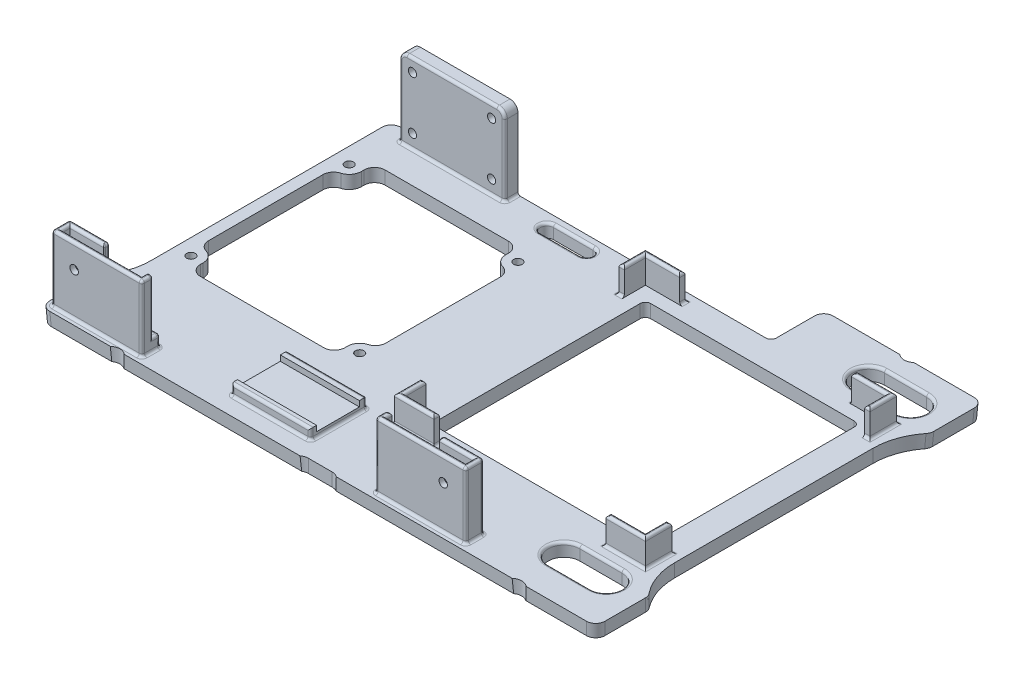
from build123d import *

# Parameters (mm, degrees)
SKETCH1_W               = 210
SKETCH1_H               = 146.5
BOSS_EXTRUDE1_DEPTH     = 5
DRAFT2_ANGLE            = 3
SKETCH2_R               = 1.625
CUT_EXTRUDE1_DEPTH      = 129.487807575
BOSS_EXTRUDE2_DEPTH     = 25
SKETCH6_W               = 34.2
SKETCH6_H               = 6.9
BOSS_EXTRUDE3_DEPTH     = 4.54
SKETCH7_W               = 30
SKETCH7_H               = 21.3
BOSS_EXTRUDE4_DEPTH     = 4
CUT_EXTRUDE2_REACH      = 167.336
SKETCH8_W               = 16.2274
SKETCH8_H               = 2.2
CUT_EXTRUDE3_DEPTH      = 182.532670176
CUT_EXTRUDE3_DEPTH_BACK = 182.532670176
SKETCH9_R               = 1.6
BOSS_EXTRUDE5_DEPTH     = 10
SKETCH13_W              = 81.17
SKETCH13_H              = 81.17
CUT_EXTRUDE5_DEPTH      = 131.801822217
SKETCH14_W              = 40
SKETCH14_H              = 5
BOSS_EXTRUDE6_DEPTH     = 30
SKETCH15_R              = 2.8
CUT_EXTRUDE6_DEPTH      = 2
CUT_EXTRUDE7_REACH      = 170.642
SKETCH16_R              = 1.55
FILLET3_R               = 1
FILLET5_R               = 4
FILLET2_R               = 2
FILLET1_R               = 3.5
FILLET6_R               = 3


# Some blends are built 0.0001 mm under size
with BuildPart() as part:
    # Sketch1 → Boss-Extrude1 (new body)
    with BuildSketch(Plane(origin=(0, 0, 0), x_dir=(1, 0, 0), z_dir=(0, 1, 0))):
        Rectangle(SKETCH1_W, SKETCH1_H)
    extrude(amount=BOSS_EXTRUDE1_DEPTH)

    # Draft2
    draft2_faces = [part.faces().sort_by_distance(p)[0] for p in [
        (105, 2.5, 0),
        (0, 2.5, -73.25),
        (-105, 2.5, 0),
        (0, 2.5, 73.25),
    ]]
    draft(draft2_faces, Plane(origin=(0, 0, 0), x_dir=(0, 0, -1), z_dir=(0, -1, 0)), DRAFT2_ANGLE)

    # Sketch2 → Cut-Extrude1 (cut, through all)
    with BuildSketch(Plane(origin=(0, 5, 0), x_dir=(1, 0, 0), z_dir=(0, 1, 0))):
        with Locations(Location((-93.262038896, 31.512038896, 0), (0, 0, 270))):
            Circle(SKETCH2_R)
        with Locations(Location((-29.262038896, 31.512038896, 0), (0, 0, 270))):
            Circle(SKETCH2_R)
        with Locations(Location((-29.262038896, -28.487961104, 0), (0, 0, 270))):
            Circle(SKETCH2_R)
        with Locations(Location((-93.262038896, -28.487961104, 0), (0, 0, 270))):
            Circle(SKETCH2_R)
        with BuildLine():
            Line((-105.262038896, 73.512038896), (44.737961104, 73.512038896))
            Line((44.737961104, 73.512038896), (44.737961104, 53.512038896))
            Line((44.737961104, 53.512038896), (-99.262038896, 53.512038896))
            Line((-99.262038896, 53.512038896), (-99.262038896, -37.566964284))
            ThreePointArc((-99.262038896, -37.566964284), (-100.812072144, -46.05402473), (-105.262038896, -53.445275908))
            Line((-105.262038896, -53.445275908), (-105.262038896, 53.512038896))
            Line((-105.262038896, 53.512038896), (-105.262038896, 73.512038896))
        make_face()
        with BuildLine():
            Line((73.554724092, 73.512038896), (78.845275908, 73.512038896))
            ThreePointArc((78.845275908, 73.512038896), (76.2, 72.512458096), (73.554724092, 73.512038896))
        make_face()
        with BuildLine():
            Line((73.532385838, -73.531881862), (78.845275908, -73.512038896))
            ThreePointArc((78.845275908, -73.512038896), (76.185060615, -72.512485994), (73.532385838, -73.531881862))
        make_face()
        with BuildLine():
            Line((-8.075290979, -75.132821732), (8.075290979, -75.132821732))
            ThreePointArc((8.075290979, -75.132821732), (6.681129133, -73.379665702), (4.541024505, -72.718458096))
            Line((4.541024505, -72.718458096), (-4.541024505, -72.718458096))
            ThreePointArc((-4.541024505, -72.718458096), (-6.681129133, -73.379665702), (-8.075290979, -75.132821732))
        make_face()
        with BuildLine():
            Line((-78.845275908, -73.512038896), (-73.554724092, -73.512038896))
            ThreePointArc((-73.554724092, -73.512038896), (-76.2, -72.512458096), (-78.845275908, -73.512038896))
        make_face()
        with BuildLine():
            Line((-34.762038896, 50.512038896), (-19.762038896, 50.512038896))
            ThreePointArc((-19.762038896, 50.512038896), (-17.262038896, 48.012038896), (-19.762038896, 45.512038896))
            Line((-19.762038896, 45.512038896), (-34.762038896, 45.512038896))
            ThreePointArc((-34.762038896, 45.512038896), (-37.262038896, 48.012038896), (-34.762038896, 50.512038896))
        make_face()
        with BuildLine():
            Line((75.737961104, 65.512038896), (91.737961104, 65.512038896))
            ThreePointArc((91.737961104, 65.512038896), (97.737961104, 59.512038896), (91.737961104, 53.512038896))
            Line((91.737961104, 53.512038896), (75.737961104, 53.512038896))
            ThreePointArc((75.737961104, 53.512038896), (69.737961104, 59.512038896), (75.737961104, 65.512038896))
        make_face()
        with BuildLine():
            Line((75.737961104, -50.012038896), (91.737961104, -50.012038896))
            ThreePointArc((91.737961104, -50.012038896), (97.737961104, -56.012038896), (91.737961104, -62.012038896))
            Line((91.737961104, -62.012038896), (75.737961104, -62.012038896))
            ThreePointArc((75.737961104, -62.012038896), (69.737961104, -56.012038896), (75.737961104, -50.012038896))
        make_face()
        with BuildLine():
            Line((-94.887038896, -24.157834085), (-94.887038896, 27.181911877))
            ThreePointArc((-94.887038896, 27.181911877), (-90.628125458, 27.710312315), (-88.637038896, 31.512038896))
            Line((-88.637038896, 31.512038896), (-88.637038896, 32.512038896))
            ThreePointArc((-88.637038896, 32.512038896), (-87.465466021, 35.340466021), (-84.637038896, 36.512038896))
            Line((-84.637038896, 36.512038896), (-37.887038896, 36.512038896))
            ThreePointArc((-37.887038896, 36.512038896), (-35.058611772, 35.340466021), (-33.887038896, 32.512038896))
            Line((-33.887038896, 32.512038896), (-33.887038896, 31.512038896))
            ThreePointArc((-33.887038896, 31.512038896), (-31.895952335, 27.710312315), (-27.637038896, 27.181911877))
            Line((-27.637038896, 27.181911877), (-27.637038896, -24.157834085))
            ThreePointArc((-27.637038896, -24.157834085), (-31.895952335, -24.686234522), (-33.887038896, -28.487961104))
            Line((-33.887038896, -28.487961104), (-33.887038896, -29.487961104))
            ThreePointArc((-33.887038896, -29.487961104), (-35.058611772, -32.316388228), (-37.887038896, -33.487961104))
            Line((-37.887038896, -33.487961104), (-84.637038896, -33.487961104))
            ThreePointArc((-84.637038896, -33.487961104), (-87.465466021, -32.316388228), (-88.637038896, -29.487961104))
            Line((-88.637038896, -29.487961104), (-88.637038896, -28.487961104))
            ThreePointArc((-88.637038896, -28.487961104), (-90.628125458, -24.686234522), (-94.887038896, -24.157834085))
        make_face()
        with BuildLine():
            Line((99.262038896, 37.566964284), (99.262038896, -37.566964284))
            ThreePointArc((99.262038896, -37.566964284), (100.812072144, -46.05402473), (105.262038896, -53.445275908))
            Line((105.262038896, -53.445275908), (105.262038896, 53.445275908))
            ThreePointArc((105.262038896, 53.445275908), (100.812072144, 46.05402473), (99.262038896, 37.566964284))
        make_face()
    extrude(amount=-CUT_EXTRUDE1_DEPTH, mode=Mode.SUBTRACT)

    # Sketch4 → Boss-Extrude2 (add)
    with BuildSketch(Plane(origin=(0, 5, 0), x_dir=(1, 0, 0), z_dir=(0, 1, 0))):
        Polygon((-101.262038896, -66.412038896), (-88.481089795, -66.412038896), (-87.462038896, -64.412038896), (-103.262038896, -64.412038896), (-103.262038896, -71.312038896), (-69.062038896, -71.312038896), (-69.062038896, -67.012038896), (-71.062038896, -67.012038896), (-71.062038896, -69.312038896), (-101.262038896, -69.312038896), align=None)
        Polygon((51.737961104, -69.312038896), (21.537961104, -69.312038896), (21.537961104, -67.012038896), (19.537961104, -67.012038896), (19.537961104, -71.312038896), (53.737961104, -71.312038896), (53.737961104, -64.412038896), (37.937961104, -64.412038896), (38.957012003, -66.412038896), (51.737961104, -66.412038896), align=None)
    extrude(amount=BOSS_EXTRUDE2_DEPTH)

    # Sketch6 → Boss-Extrude3 (add)
    with BuildSketch(Plane(origin=(0, 5, 0), x_dir=(1, 0, 0), z_dir=(0, 1, 0))):
        with Locations((-86.162038896, -67.862038896)):
            Rectangle(SKETCH6_W, SKETCH6_H)
        with Locations((36.637961104, -67.862038896)):
            Rectangle(SKETCH6_W, SKETCH6_H)
    extrude(amount=BOSS_EXTRUDE3_DEPTH)

    # Sketch7 → Boss-Extrude4 (add)
    with BuildSketch(Plane(origin=(0, 5, 0), x_dir=(1, 0, 0), z_dir=(0, 1, 0))):
        with Locations((-24.762038896, -55.987038896)):
            Rectangle(SKETCH7_W, SKETCH7_H)
    extrude(amount=BOSS_EXTRUDE4_DEPTH)

    # Sketch8 → Cut-Extrude2 (cut, up to next)
    with BuildSketch(Plane.ZY.offset(39.762038896), mode=Mode.PRIVATE) as cut_extrude2_sk1:
        with Locations((56.218338896, 8)):
            Rectangle(SKETCH8_W, SKETCH8_H)
    cut_extrude2_tool1 = extrude(cut_extrude2_sk1.sketch, amount=-CUT_EXTRUDE2_REACH, mode=Mode.PRIVATE) & part.part
    add(cut_extrude2_tool1.solids().sort_by_distance((-39.762039, 8, 56.218339))[0], mode=Mode.SUBTRACT)

    # Sketch9 → Cut-Extrude3 (cut, two sides: drawn at the far end of the back side and taken through both)
    with BuildSketch(Plane.XY.offset(71.312038896).offset(-CUT_EXTRUDE3_DEPTH_BACK)):
        with Locations((-94.737038896, 21.1)):
            Circle(SKETCH9_R)
        with Locations((45.212961104, 21.1)):
            Circle(SKETCH9_R)
    extrude(amount=CUT_EXTRUDE3_DEPTH + CUT_EXTRUDE3_DEPTH_BACK, mode=Mode.SUBTRACT)

    # Sketch10 → Boss-Extrude5 (add)
    with BuildSketch(Plane(origin=(0, 5, 0), x_dir=(1, 0, 0), z_dir=(0, 1, 0))):
        Polygon((80.762038896, 48.012038896), (93.762038896, 48.012038896), (93.762038896, 40.012038896), (95.762038896, 40.012038896), (95.762038896, 50.012038896), (80.762038896, 50.012038896), align=None)
        Polygon((15.592038896, -43.157961104), (2.592038896, -43.157961104), (2.592038896, -35.157961104), (0.592038896, -35.157961104), (0.592038896, -45.157961104), (15.592038896, -45.157961104), align=None)
        Polygon((80.762038896, -45.157961104), (80.762038896, -43.157961104), (93.762038896, -43.157961104), (93.762038896, -35.157961104), (95.762038896, -35.157961104), (95.762038896, -45.157961104), align=None)
        Polygon((15.592038896, 50.012038896), (15.592038896, 48.012038896), (2.592038896, 48.012038896), (2.592038896, 40.012038896), (0.592038896, 40.012038896), (0.592038896, 50.012038896), align=None)
    extrude(amount=BOSS_EXTRUDE5_DEPTH)

    # Sketch13 → Cut-Extrude5 (cut, through all)
    with BuildSketch(Plane(origin=(0, 5, 0), x_dir=(1, 0, 0), z_dir=(0, 1, 0))):
        with Locations((48.177038896, 2.427038896)):
            Rectangle(SKETCH13_W, SKETCH13_H)
    extrude(amount=-CUT_EXTRUDE5_DEPTH, mode=Mode.SUBTRACT)

    # Sketch14 → Boss-Extrude6 (add)
    with BuildSketch(Plane(origin=(0, 5, 0), x_dir=(1, 0, 0), z_dir=(0, 1, 0))):
        with Locations((-71.262038896, 51.012038896)):
            Rectangle(SKETCH14_W, SKETCH14_H)
    extrude(amount=BOSS_EXTRUDE6_DEPTH)

    # Sketch15 → Cut-Extrude6 (cut)
    with BuildSketch(Plane(origin=(0, 0, -53.512038896), x_dir=(-1, 0, 0), z_dir=(0, 0, -1))):
        with Locations((56.262038673, 30.200000149)):
            Circle(SKETCH15_R)
        with Locations((86.26203912, 30.200000149)):
            Circle(SKETCH15_R)
        with Locations((56.262038673, 10.199999851)):
            Circle(SKETCH15_R)
        with Locations((86.26203912, 10.199999851)):
            Circle(SKETCH15_R)
    extrude(amount=-CUT_EXTRUDE6_DEPTH, mode=Mode.SUBTRACT)

    # Sketch16 → Cut-Extrude7 (cut, up to next)
    with BuildSketch(Plane(origin=(0, 0, -53.512038896), x_dir=(-1, 0, 0), z_dir=(0, 0, -1)), mode=Mode.PRIVATE) as cut_extrude7_sk1:
        with Locations((56.262038673, 30.200000149)):
            Circle(SKETCH16_R)
    cut_extrude7_tool1 = extrude(cut_extrude7_sk1.sketch, amount=-CUT_EXTRUDE7_REACH, mode=Mode.PRIVATE) & part.part
    # Sketch16 → Cut-Extrude7 (cut, up to next)
    with BuildSketch(Plane(origin=(0, 0, -53.512038896), x_dir=(-1, 0, 0), z_dir=(0, 0, -1)), mode=Mode.PRIVATE) as cut_extrude7_sk2:
        with Locations((86.26203912, 30.200000149)):
            Circle(SKETCH16_R)
    cut_extrude7_tool2 = extrude(cut_extrude7_sk2.sketch, amount=-CUT_EXTRUDE7_REACH, mode=Mode.PRIVATE) & part.part
    # Sketch16 → Cut-Extrude7 (cut, up to next)
    with BuildSketch(Plane(origin=(0, 0, -53.512038896), x_dir=(-1, 0, 0), z_dir=(0, 0, -1)), mode=Mode.PRIVATE) as cut_extrude7_sk3:
        with Locations((86.26203912, 10.199999851)):
            Circle(SKETCH16_R)
    cut_extrude7_tool3 = extrude(cut_extrude7_sk3.sketch, amount=-CUT_EXTRUDE7_REACH, mode=Mode.PRIVATE) & part.part
    # Sketch16 → Cut-Extrude7 (cut, up to next)
    with BuildSketch(Plane(origin=(0, 0, -53.512038896), x_dir=(-1, 0, 0), z_dir=(0, 0, -1)), mode=Mode.PRIVATE) as cut_extrude7_sk4:
        with Locations((56.262038673, 10.199999851)):
            Circle(SKETCH16_R)
    cut_extrude7_tool4 = extrude(cut_extrude7_sk4.sketch, amount=-CUT_EXTRUDE7_REACH, mode=Mode.PRIVATE) & part.part
    add(cut_extrude7_tool1.solids().sort_by_distance((-56.262039, 30.2, -53.512039))[0], mode=Mode.SUBTRACT)
    add(cut_extrude7_tool2.solids().sort_by_distance((-86.262039, 30.2, -53.512039))[0], mode=Mode.SUBTRACT)
    add(cut_extrude7_tool3.solids().sort_by_distance((-86.262039, 10.2, -53.512039))[0], mode=Mode.SUBTRACT)
    add(cut_extrude7_tool4.solids().sort_by_distance((-56.262039, 10.2, -53.512039))[0], mode=Mode.SUBTRACT)

    # Fillet3
    fillet3_edges = [part.edges().sort_by_distance(p)[0] for p in [
        (-37.262038896, 5, -48.012038896),
        (-27.262038896, 5, -45.512038896),
        (-17.262038896, 5, -48.012038896),
        (-27.262038896, 5, -50.512038896),
        (69.737961104, 5, 56.012038896),
        (83.737961104, 5, 62.012038896),
        (97.737961104, 5, 56.012038896),
        (83.737961104, 5, 50.012038896),
        (-86.162038896, 30, 69.312038896),
        (-86.162038896, 5, 64.412038896),
        (-87.462038896, 19.77, 64.412038896),
        (-103.262038896, 5, 67.862038896),
        (-103.262038896, 17.5, 64.412038896),
        (-86.162038896, 5, 71.312038896),
        (-103.262038896, 17.5, 71.312038896),
        (-69.062038896, 5, 67.862038896),
        (-69.062038896, 17.5, 71.312038896),
        (-69.062038896, 19.77, 67.012038896),
        (-101.262038896, 30, 67.862038896),
        (-94.871564346, 30, 66.412038896),
        (-87.971564346, 30, 65.412038896),
        (-95.362038896, 30, 64.412038896),
        (-103.262038896, 30, 67.862038896),
        (-86.162038896, 30, 71.312038896),
        (-69.062038896, 30, 69.162038896),
        (-70.062038896, 30, 67.012038896),
        (-71.062038896, 30, 68.162038896),
        (38.447486553, 30, 65.412038896),
        (37.937961104, 19.77, 64.412038896),
        (45.347486553, 30, 66.412038896),
        (51.737961104, 30, 67.862038896),
        (36.637961104, 30, 69.312038896),
        (21.537961104, 30, 68.162038896),
        (20.537961104, 30, 67.012038896),
        (19.537961104, 30, 69.162038896),
        (19.537961104, 19.77, 67.012038896),
        (36.637961104, 30, 71.312038896),
        (19.537961104, 17.5, 71.312038896),
        (53.737961104, 30, 67.862038896),
        (53.737961104, 17.5, 71.312038896),
        (45.837961104, 30, 64.412038896),
        (53.737961104, 17.5, 64.412038896),
        (36.637961104, 5, 64.412038896),
        (53.737961104, 5, 67.862038896),
        (36.637961104, 5, 71.312038896),
        (19.537961104, 5, 67.862038896),
        (-78.262038896, 9.54, 64.412038896),
        (-69.062038896, 7.27, 64.412038896),
        (-69.062038896, 9.54, 65.712038896),
        (19.537961104, 9.54, 65.712038896),
        (19.537961104, 7.27, 64.412038896),
        (28.737961104, 9.54, 64.412038896),
        (-39.762038896, 5, 55.987038896),
        (-39.762038896, 7, 45.337038896),
        (-24.762038896, 5, 66.637038896),
        (-39.762038896, 7, 66.637038896),
        (-9.762038896, 5, 55.987038896),
        (-9.762038896, 7, 66.637038896),
        (-24.762038896, 5, 45.337038896),
        (-9.762038896, 7, 45.337038896),
        (-24.762038896, 9, 66.637038896),
        (-24.762038896, 9, 45.337038896),
        (80.762038896, 5, -49.012038896),
        (94.762038896, 5, -40.012038896),
        (95.762038896, 5, -45.012038896),
        (88.262038896, 5, -50.012038896),
        (80.762038896, 15, -49.012038896),
        (87.262038896, 15, -48.012038896),
        (93.762038896, 15, -44.012038896),
        (94.762038896, 15, -40.012038896),
        (95.762038896, 15, -45.012038896),
        (88.262038896, 15, -50.012038896),
        (15.592038896, 5, 44.157961104),
        (1.592038896, 5, 35.157961104),
        (0.592038896, 5, 40.157961104),
        (8.092038896, 5, 45.157961104),
        (15.592038896, 15, 44.157961104),
        (9.092038896, 15, 43.157961104),
        (2.592038896, 15, 39.157961104),
        (1.592038896, 15, 35.157961104),
        (0.592038896, 15, 40.157961104),
        (8.092038896, 15, 45.157961104),
        (88.262038896, 5, 45.157961104),
        (95.762038896, 5, 40.157961104),
        (94.762038896, 5, 35.157961104),
        (80.762038896, 5, 44.157961104),
        (88.262038896, 15, 45.157961104),
        (95.762038896, 15, 40.157961104),
        (94.762038896, 15, 35.157961104),
        (93.762038896, 15, 39.157961104),
        (87.262038896, 15, 43.157961104),
        (80.762038896, 15, 44.157961104),
        (8.092038896, 5, -50.012038896),
        (0.592038896, 5, -45.012038896),
        (1.592038896, 5, -40.012038896),
        (15.592038896, 5, -49.012038896),
        (8.092038896, 15, -50.012038896),
        (0.592038896, 15, -45.012038896),
        (1.592038896, 15, -40.012038896),
        (2.592038896, 15, -44.012038896),
        (9.092038896, 15, -48.012038896),
        (15.592038896, 15, -49.012038896),
        (-91.262038896, 5, -51.012038896),
        (-71.262038896, 5, -48.512038896),
        (-91.262038896, 20, -48.512038896),
        (-51.262038896, 5, -51.012038896),
        (-51.262038896, 20, -48.512038896),
        (-71.262038896, 35, -48.512038896),
        (69.737961104, 5, -59.512038896),
        (97.737961104, 5, -59.512038896),
        (83.737961104, 5, -65.512038896),
    ]]
    fillet(fillet3_edges, radius=FILLET3_R - 0.0001)  # a hair under: the kernel refuses the full size

    # Fillet5
    fillet5_edges = [part.edges().sort_by_distance(p)[0] for p in [
        (-94.887038896, 2.5, 24.157834085),
        (-94.887038896, 2.5, -27.181911877),
        (-27.637038896, 2.5, -27.181911877),
        (-27.637038896, 2.5, 24.157834085),
    ]]
    fillet(fillet5_edges, radius=FILLET5_R)

    # Fillet2
    fillet2_edges = [part.edges().sort_by_distance(p)[0] for p in [
        (44.737961104, 2.5, -53.512038896),
        (88.762038896, 2.5, -43.012038896),
        (88.762038896, 2.5, 38.157961104),
        (7.592038896, 2.5, 38.157961104),
        (7.592038896, 2.5, -43.012038896),
    ]]
    fillet(fillet2_edges, radius=FILLET2_R)

    # Fillet1
    fillet1_edges = [part.edges().sort_by_distance(p)[0] for p in [
        (105.131015444, 2.499923602, -53.29541402),
        (105.131015444, 2.499923602, 53.29541402),
        (44.737961104, 2.5, -73.381019448),
        (-105.131015444, 2.499923602, 53.29541402),
        (-99.262038896, 2.5, -53.512038896),
        (105.131019448, 2.5, -73.381019448),
        (105.131019448, 2.5, 73.381019448),
        (-105.131019448, 2.5, 73.381019448),
    ]]
    fillet(fillet1_edges, radius=FILLET1_R)

    # Fillet6
    # the kernel refuses this fillet: 3 mm, written as the material it takes off along each edge
    with BuildSketch(Plane(origin=(-88.262038896, 32, -48.512038896), x_dir=(0, 1, 0), z_dir=(1, 0, 0))) as fillet6_piece_1:
        with BuildLine():
            CenterArc((2.0001, -0.9999), 0.9999, 0, 90)
            Line((3, -0.9999), (3, 0))
            Line((3, 0), (2.0001, 0))
        make_face()
    revolve(axis=Axis((-88.262038896, 32, -48.512038896), (0, 0, 1)), revolution_arc=90, mode=Mode.SUBTRACT)
    with BuildSketch(Plane(origin=(-54.262038896, 32, -48.512038896), x_dir=(1, 0, 0), z_dir=(0, -1, 0))) as fillet6_piece_2:
        with BuildLine():
            CenterArc((2.0001, -0.9999), 0.9999, 0, 90)
            Line((3, -0.9999), (3, 0))
            Line((3, 0), (2.0001, 0))
        make_face()
    revolve(axis=Axis((-54.262038896, 32, -48.512038896), (0, 0, 1)), revolution_arc=90, mode=Mode.SUBTRACT)
    with BuildSketch(Plane(origin=(-91.262038896, 35, -48.512038896), x_dir=(0, -1, 0), z_dir=(0, 0, -1)), Plane(origin=(-51.262038896, 35, -61.012038896), x_dir=(0, -1, 0), z_dir=(0, 0, 1))) as fillet6_piece_3:
        with BuildLine():
            CenterArc((FILLET6_R, -FILLET6_R), FILLET6_R, 90, 90)
            Line((0, -FILLET6_R), (0, 0))
            Line((0, 0), (FILLET6_R, 0))
        make_face()
    extrude(amount=12.5, mode=Mode.SUBTRACT)


solid = part.part
